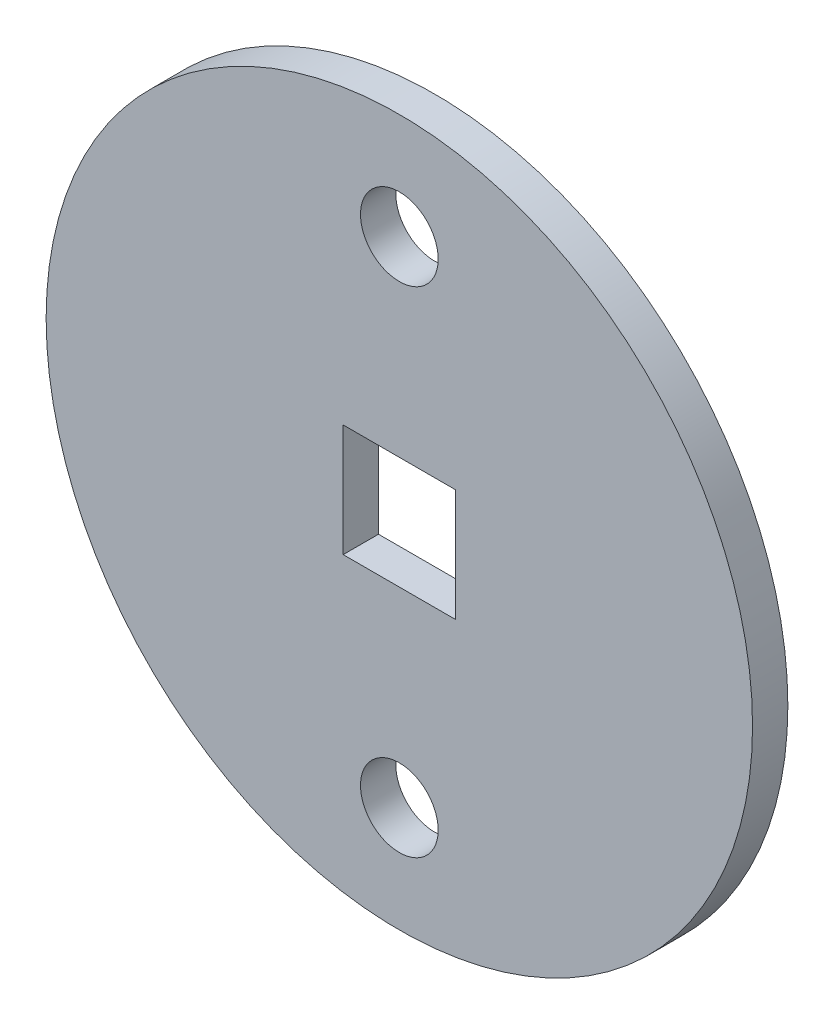
from build123d import *

# Parameters (mm, degrees)
SKETCH1_R          = 10
SKETCH1_R_2        = 1.1
BASE_FLANGE1_DEPTH = 1
CUT_EXTRUDE1_DEPTH = 10


# Sheet-metal steps are written as plain solids
with BuildPart() as part:
    # Sketch1 → Base-Flange1 (new body)
    with BuildSketch(Plane.XY):
        Circle(SKETCH1_R)
        with Locations((0, 7)):
            Circle(SKETCH1_R_2, mode=Mode.SUBTRACT)
        with Locations((0, -7)):
            Circle(SKETCH1_R_2, mode=Mode.SUBTRACT)
    extrude(amount=-BASE_FLANGE1_DEPTH)

    # Sketch6 → Cut-Extrude1 (cut)
    with BuildSketch(Plane.XY):
        Polygon((1.59, 0), (1.59, 1.59), (-1.59, 1.59), (-1.59, -1.59), (1.59, -1.59), align=None)
    extrude(amount=-CUT_EXTRUDE1_DEPTH, mode=Mode.SUBTRACT)


solid = part.part
